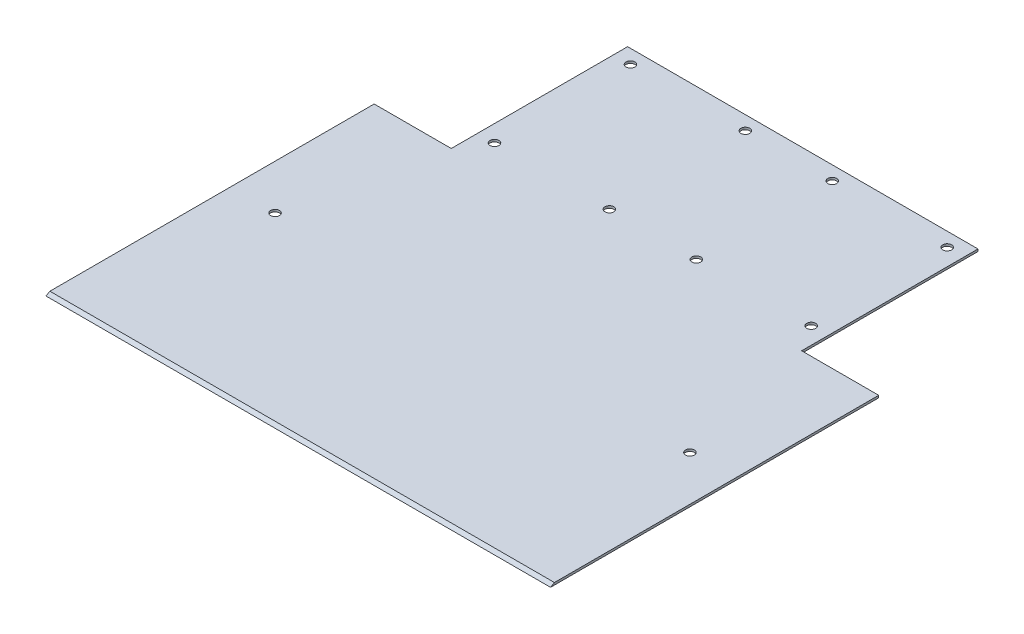
from build123d import *

# Parameters (mm, degrees)
SALIENTE_EXTRUIR1_DEPTH = 0.8
CORTAR_EXTRUIR1_REACH   = 203.248
CORTAR_EXTRUIR2_REACH   = 129.282
CROQUIS3_R              = 1.585
CORTAR_EXTRUIR3_REACH   = 129.282
CROQUIS4_R              = 1.585
CORTAR_EXTRUIR4_REACH   = 129.282
CROQUIS6_R              = 1.585


with BuildPart() as part:
    # Croquis1 → Saliente-Extruir1 (new body)
    with BuildSketch(Plane(origin=(0, 0, 0), x_dir=(1, 0, 0), z_dir=(0, 1, 0))):
        Polygon((-62.5, 90), (-62.5, 27.08), (-90, 27.08), (-90, -90), (90, -90), (90, 27.08), (62.5, 27.08), (62.5, 90), align=None)
    extrude(amount=SALIENTE_EXTRUIR1_DEPTH)

    # Croquis2 → Cortar-Extruir1 (cut, up to next)
    with BuildSketch(Plane.ZY.offset(90), mode=Mode.PRIVATE) as cortar_extruir1_sk1:
        Polygon((90, 0), (88.614359354, 0.8), (90, 0.8), align=None)
    cortar_extruir1_tool1 = extrude(cortar_extruir1_sk1.sketch, amount=-CORTAR_EXTRUIR1_REACH, mode=Mode.PRIVATE) & part.part
    add(cortar_extruir1_tool1.solids().sort_by_distance((-90, 0.533333, 89.53812))[0], mode=Mode.SUBTRACT)

    # Croquis3 → Cortar-Extruir2 (cut, up to next)
    with BuildSketch(Plane(origin=(0, 0.8, 0), x_dir=(1, 0, 0), z_dir=(0, 1, 0)), mode=Mode.PRIVATE) as cortar_extruir2_sk1:
        with Locations((74, -24.279339937)):
            Circle(CROQUIS3_R)
    cortar_extruir2_tool1 = extrude(cortar_extruir2_sk1.sketch, amount=-CORTAR_EXTRUIR2_REACH, mode=Mode.PRIVATE) & part.part
    cortar_extruir2 = cortar_extruir2_tool1.solids().sort_by_distance((74, 0.8, 24.27934))[0]
    add(cortar_extruir2, mode=Mode.SUBTRACT)

    # Simetría1: Cortar-Extruir2 across plane
    add(cortar_extruir2.mirror(Plane(origin=(0, 0, 0), x_dir=(0, 0, 1), z_dir=(1, 0, 0))), mode=Mode.SUBTRACT)

    # Croquis4 → Cortar-Extruir3 (cut, up to next)
    with BuildSketch(Plane(origin=(0, 0.8, 0), x_dir=(1, 0, 0), z_dir=(0, 1, 0)), mode=Mode.PRIVATE) as cortar_extruir3_sk1:
        with Locations((-56.5, 36.505640646)):
            Circle(CROQUIS4_R)
    cortar_extruir3_tool1 = extrude(cortar_extruir3_sk1.sketch, amount=-CORTAR_EXTRUIR3_REACH, mode=Mode.PRIVATE) & part.part
    # Croquis4 → Cortar-Extruir3 (cut, up to next)
    with BuildSketch(Plane(origin=(0, 0.8, 0), x_dir=(1, 0, 0), z_dir=(0, 1, 0)), mode=Mode.PRIVATE) as cortar_extruir3_sk2:
        with Locations((-15.5, 36.505640646)):
            Circle(CROQUIS4_R)
    cortar_extruir3_tool2 = extrude(cortar_extruir3_sk2.sketch, amount=-CORTAR_EXTRUIR3_REACH, mode=Mode.PRIVATE) & part.part
    # Croquis4 → Cortar-Extruir3 (cut, up to next)
    with BuildSketch(Plane(origin=(0, 0.8, 0), x_dir=(1, 0, 0), z_dir=(0, 1, 0)), mode=Mode.PRIVATE) as cortar_extruir3_sk3:
        with Locations((-15.5, 85.005640646)):
            Circle(CROQUIS4_R)
    cortar_extruir3_tool3 = extrude(cortar_extruir3_sk3.sketch, amount=-CORTAR_EXTRUIR3_REACH, mode=Mode.PRIVATE) & part.part
    # Croquis4 → Cortar-Extruir3 (cut, up to next)
    with BuildSketch(Plane(origin=(0, 0.8, 0), x_dir=(1, 0, 0), z_dir=(0, 1, 0)), mode=Mode.PRIVATE) as cortar_extruir3_sk4:
        with Locations((-56.5, 85.005640646)):
            Circle(CROQUIS4_R)
    cortar_extruir3_tool4 = extrude(cortar_extruir3_sk4.sketch, amount=-CORTAR_EXTRUIR3_REACH, mode=Mode.PRIVATE) & part.part
    add(cortar_extruir3_tool1.solids().sort_by_distance((-56.5, 0.8, -36.505641))[0], mode=Mode.SUBTRACT)
    add(cortar_extruir3_tool2.solids().sort_by_distance((-15.5, 0.8, -36.505641))[0], mode=Mode.SUBTRACT)
    add(cortar_extruir3_tool3.solids().sort_by_distance((-15.5, 0.8, -85.005641))[0], mode=Mode.SUBTRACT)
    add(cortar_extruir3_tool4.solids().sort_by_distance((-56.5, 0.8, -85.005641))[0], mode=Mode.SUBTRACT)

    # Croquis6 → Cortar-Extruir4 (cut, up to next)
    with BuildSketch(Plane(origin=(0, 0.8, 0), x_dir=(1, 0, 0), z_dir=(0, 1, 0)), mode=Mode.PRIVATE) as cortar_extruir4_sk1:
        with Locations((56.5, 85.005640646)):
            Circle(CROQUIS6_R)
    cortar_extruir4_tool1 = extrude(cortar_extruir4_sk1.sketch, amount=-CORTAR_EXTRUIR4_REACH, mode=Mode.PRIVATE) & part.part
    # Croquis6 → Cortar-Extruir4 (cut, up to next)
    with BuildSketch(Plane(origin=(0, 0.8, 0), x_dir=(1, 0, 0), z_dir=(0, 1, 0)), mode=Mode.PRIVATE) as cortar_extruir4_sk2:
        with Locations((15.5, 85.005640646)):
            Circle(CROQUIS6_R)
    cortar_extruir4_tool2 = extrude(cortar_extruir4_sk2.sketch, amount=-CORTAR_EXTRUIR4_REACH, mode=Mode.PRIVATE) & part.part
    # Croquis6 → Cortar-Extruir4 (cut, up to next)
    with BuildSketch(Plane(origin=(0, 0.8, 0), x_dir=(1, 0, 0), z_dir=(0, 1, 0)), mode=Mode.PRIVATE) as cortar_extruir4_sk3:
        with Locations((15.5, 36.505640646)):
            Circle(CROQUIS6_R)
    cortar_extruir4_tool3 = extrude(cortar_extruir4_sk3.sketch, amount=-CORTAR_EXTRUIR4_REACH, mode=Mode.PRIVATE) & part.part
    # Croquis6 → Cortar-Extruir4 (cut, up to next)
    with BuildSketch(Plane(origin=(0, 0.8, 0), x_dir=(1, 0, 0), z_dir=(0, 1, 0)), mode=Mode.PRIVATE) as cortar_extruir4_sk4:
        with Locations((56.5, 36.505640646)):
            Circle(CROQUIS6_R)
    cortar_extruir4_tool4 = extrude(cortar_extruir4_sk4.sketch, amount=-CORTAR_EXTRUIR4_REACH, mode=Mode.PRIVATE) & part.part
    add(cortar_extruir4_tool1.solids().sort_by_distance((56.5, 0.8, -85.005641))[0], mode=Mode.SUBTRACT)
    add(cortar_extruir4_tool2.solids().sort_by_distance((15.5, 0.8, -85.005641))[0], mode=Mode.SUBTRACT)
    add(cortar_extruir4_tool3.solids().sort_by_distance((15.5, 0.8, -36.505641))[0], mode=Mode.SUBTRACT)
    add(cortar_extruir4_tool4.solids().sort_by_distance((56.5, 0.8, -36.505641))[0], mode=Mode.SUBTRACT)


solid = part.part
